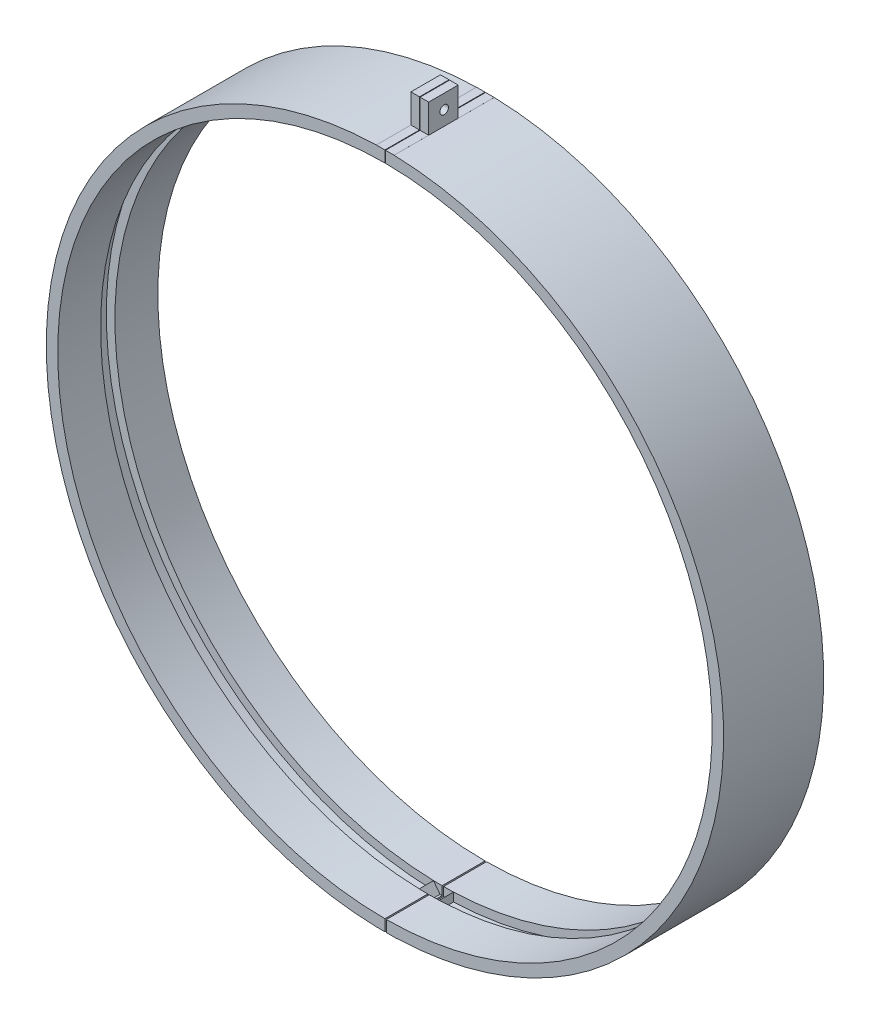
from build123d import *

# Parameters (mm, degrees)
SKETCH1_R      = 118.4
SKETCH1_R_2    = 114.4
EXTRUDE1_DEPTH = 15
SKETCH2_R      = 118.4
SKETCH2_R_2    = 117.4
EXTRUDE2_DEPTH = 5
SKETCH3_R      = 118.4
SKETCH3_R_2    = 114.4
EXTRUDE3_DEPTH = 15
EXTRUDE4_DEPTH = 35
SKETCH5_W      = 0.2
SKETCH5_H      = 17.636939157
SKETCH5_W_2    = 0.5
SKETCH5_H_2    = 21.284938381
EXTRUDE5_DEPTH = 179.129503452
SKETCH6_R      = 1.5
SKETCH6_W      = 12.085553783
SKETCH6_H      = 10.038012859
SKETCH6_W_2    = 12.582360216
EXTRUDE6_DEPTH = 181.137503036


with BuildPart() as part:
    # Sketch1 → Extrude1 (new body)
    with BuildSketch(Plane.XY):
        Circle(SKETCH1_R)
        Circle(SKETCH1_R_2, mode=Mode.SUBTRACT)
    extrude(amount=EXTRUDE1_DEPTH)

    # Sketch2 → Extrude2 (add)
    with BuildSketch(Plane.XY.offset(15)):
        Circle(SKETCH2_R)
        Circle(SKETCH2_R_2, mode=Mode.SUBTRACT)
    extrude(amount=EXTRUDE2_DEPTH)

    # Sketch3 → Extrude3 (add)
    with BuildSketch(Plane.XY.offset(20)):
        Circle(SKETCH3_R)
        Circle(SKETCH3_R_2, mode=Mode.SUBTRACT)
    extrude(amount=EXTRUDE3_DEPTH)

    # Sketch4 → Extrude4 (add)
    with BuildSketch(Plane.XY.offset(35)):
        with BuildLine():
            Line((0, 118.4), (0, 128.4))
            Line((0, 128.4), (-3, 128.4))
            Line((-3, 128.4), (-3, 114.360657571))
            ThreePointArc((-3, 114.360657571), (-2.167963765, 116.876422229), (0, 118.4))
        make_face()
        Polygon((0.2, 128.4), (3.2, 128.4), (3.2, 114.355235997), (0.2, 118.399831081), align=None)
        Polygon((0, -118.4), (0, -128.4), (-3, -128.4), (-3, -114.360657571), align=None)
        Polygon((0.5, -118.398944252), (0.5, -128.4), (4, -128.4), (4, -114.330048544), align=None)
    extrude(amount=-EXTRUDE4_DEPTH)

    # Sketch5 → Extrude5 (cut, through all)
    with BuildSketch(Plane.XY.offset(35)):
        with Locations((0.1, 119.581530422)):
            Rectangle(SKETCH5_W, SKETCH5_H)
        with Locations((0.25, -117.757530809)):
            Rectangle(SKETCH5_W_2, SKETCH5_H_2)
    extrude(amount=-EXTRUDE5_DEPTH, mode=Mode.SUBTRACT)


with BuildPart() as extrude5_piece_1:
    # of the separate pieces the step leaves, piece 1, a body of its own (extrude5_pieces)
    add(part.part.solids().sort_by_distance((0.2, 128.4, 35))[0])


with BuildPart() as extrude5_piece_2:
    # of the separate pieces the step leaves, piece 2, a body of its own (extrude5_pieces)
    add(part.part.solids().sort_by_distance((0, 114.4, 35))[0])


with BuildPart() as extrude6_tool:
    # Sketch6 → Extrude6 (new, through all)
    with BuildSketch(Plane.ZY.offset(3)):
        with Locations((17.5, 123.380993571)):
            Circle(SKETCH6_R)
        with Locations((17.5, -123.380993571)):
            Circle(SKETCH6_R)
        with Locations((28.957223109, 123.380993571)):
            Rectangle(SKETCH6_W, SKETCH6_H)
        with Locations((6.291180108, 123.380993571)):
            Rectangle(SKETCH6_W_2, SKETCH6_H)
        with Locations((28.957223109, -123.380993571)):
            Rectangle(SKETCH6_W, SKETCH6_H)
        with Locations((6.291180108, -123.380993571)):
            Rectangle(SKETCH6_W_2, SKETCH6_H)
    extrude(amount=-EXTRUDE6_DEPTH)


with BuildPart() as extrude5_piece_1_1:
    add(extrude5_piece_1.part)

    # Extrude6: cut by extrude6_tool
    add(extrude6_tool.part, mode=Mode.SUBTRACT)


with BuildPart() as extrude5_piece_2_1:
    add(extrude5_piece_2.part)

    # Extrude6: cut by extrude6_tool
    add(extrude6_tool.part, mode=Mode.SUBTRACT)


solid = Compound([extrude5_piece_1_1.part, extrude5_piece_2_1.part])
